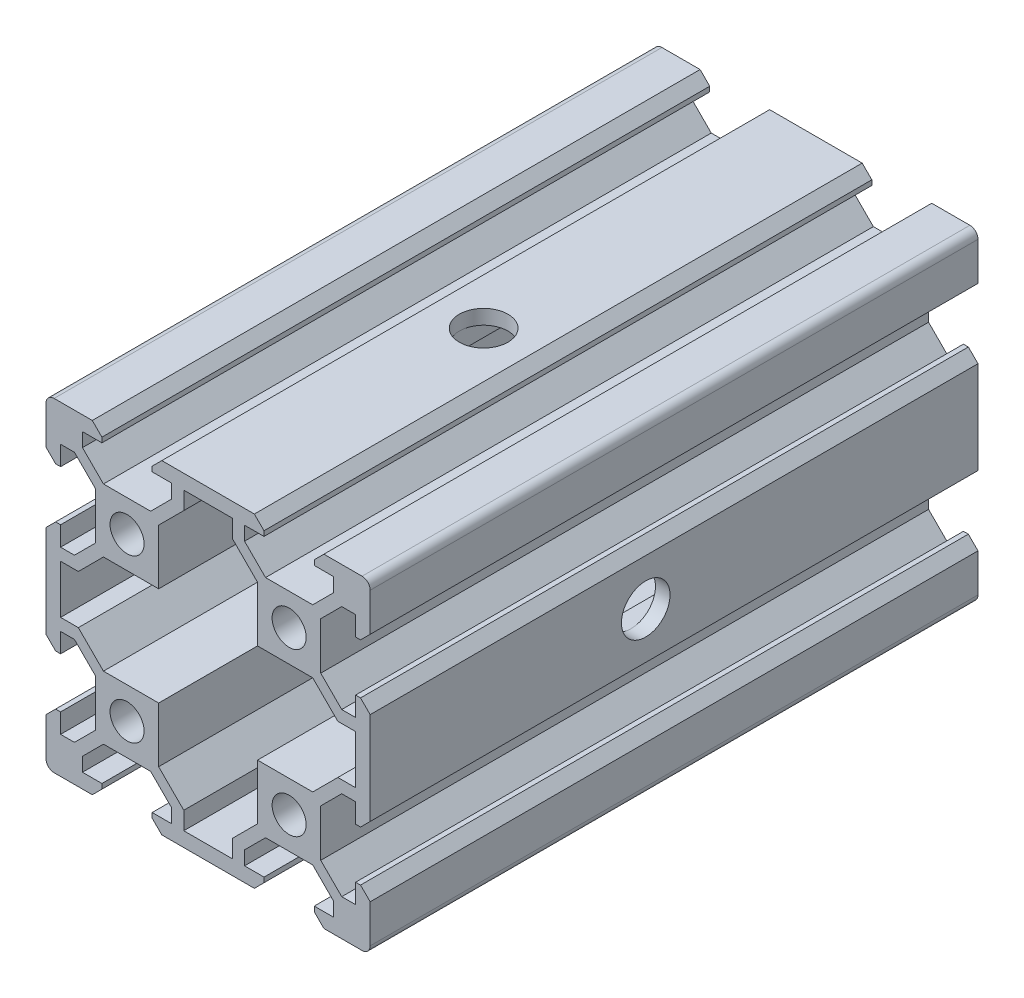
from build123d import *

# Parameters (mm, degrees)
SKETCH_1_R         = 2.1
EXTRUDE_1_DEPTH    = 75
VERRUNDUNG1_R      = 1
SKETCH1_R          = 3
CUT_EXTRUDE1_DEPTH = 88.321245983


with BuildPart() as part:
    # 草图1 → 凸台-拉伸1 (new body)
    with BuildSketch(Plane.XY):
        Polygon((5.71, 20), (-5.71, 20), (-6.9, 18.81), (-6.9, 18.2), (-4.5, 18.2), (-4.5, 16.489949494), (-7.089949494, 13.9), (-12.910050506, 13.9), (-15.5, 16.489949494), (-15.5, 18.2), (-13.1, 18.2), (-13.1, 18.81), (-14.29, 20), (-20, 20), (-20, 14.29), (-18.81, 13.1), (-18.2, 13.1), (-18.2, 15.5), (-16.489949494, 15.5), (-13.9, 12.910050506), (-13.9, 7.089949494), (-16.489949494, 4.5), (-18.2, 4.5), (-18.2, 6.9), (-18.81, 6.9), (-20, 5.71), (-20, -5.71), (-18.81, -6.9), (-18.2, -6.9), (-18.2, -4.5), (-16.489949494, -4.5), (-13.9, -7.089949494), (-13.9, -12.910050506), (-16.489949494, -15.5), (-18.2, -15.5), (-18.2, -13.1), (-18.81, -13.1), (-20, -14.29), (-20, -20), (-14.29, -20), (-13.1, -18.81), (-13.1, -18.2), (-15.5, -18.2), (-15.5, -16.489949494), (-12.910050506, -13.9), (-7.089949494, -13.9), (-4.5, -16.489949494), (-4.5, -18.2), (-6.9, -18.2), (-6.9, -18.81), (-5.71, -20), (5.71, -20), (6.9, -18.81), (6.9, -18.2), (4.5, -18.2), (4.5, -16.489949494), (7.089949494, -13.9), (12.910050506, -13.9), (15.5, -16.489949494), (15.5, -18.2), (13.1, -18.2), (13.1, -18.81), (14.29, -20), (20, -20), (20, -14.29), (18.81, -13.1), (18.2, -13.1), (18.2, -15.5), (16.489949494, -15.5), (13.9, -12.910050506), (13.9, -7.089949494), (16.489949494, -4.5), (18.2, -4.5), (18.2, -6.9), (18.81, -6.9), (20, -5.71), (20, 5.71), (18.81, 6.9), (18.2, 6.9), (18.2, 4.5), (16.489949494, 4.5), (13.9, 7.089949494), (13.9, 12.910050506), (16.489949494, 15.5), (18.2, 15.5), (18.2, 13.1), (18.81, 13.1), (20, 14.29), (20, 20), (14.29, 20), (13.1, 18.81), (13.1, 18.2), (15.5, 18.2), (15.5, 16.489949494), (12.910050506, 13.9), (7.089949494, 13.9), (4.5, 16.489949494), (4.5, 18.2), (6.9, 18.2), (6.9, 18.81), align=None)
        with Locations((-10, 10)):
            Circle(SKETCH_1_R, mode=Mode.SUBTRACT)
        with Locations((-10, -10)):
            Circle(SKETCH_1_R, mode=Mode.SUBTRACT)
        with Locations((10, -10)):
            Circle(SKETCH_1_R, mode=Mode.SUBTRACT)
        with Locations((10, 10)):
            Circle(SKETCH_1_R, mode=Mode.SUBTRACT)
        Polygon((-6.1, 6.1), (-6.1, 12.910050506), (-3, 16.010050506), (-3, 18.2), (3, 18.2), (3, 16.010050506), (6.1, 12.910050506), (6.1, 6.1), (12.910050506, 6.1), (16.010050506, 3), (18.2, 3), (18.2, -3), (16.010050506, -3), (12.910050506, -6.1), (6.1, -6.1), (6.1, -12.910050506), (3, -16.010050506), (3, -18.2), (-3, -18.2), (-3, -16.010050506), (-6.1, -12.910050506), (-6.1, -6.1), (-12.910050506, -6.1), (-16.010050506, -3), (-18.2, -3), (-18.2, 3), (-16.010050506, 3), (-12.910050506, 6.1), align=None, mode=Mode.SUBTRACT)
    extrude(amount=EXTRUDE_1_DEPTH)

    # Verrundung1
    verrundung1_edges = [part.edges().sort_by_distance(p)[0] for p in [
        (20, -20, 37.5),
        (-20, -20, 37.5),
        (-20, 20, 37.5),
        (20, 20, 37.5),
    ]]
    fillet(verrundung1_edges, radius=VERRUNDUNG1_R)

    # Sketch1 → Cut-Extrude1 (cut, through all)
    with BuildSketch(Plane.ZY.offset(20)):
        with Locations((41, 0)):
            Circle(SKETCH1_R)
    cut_extrude1 = extrude(amount=-CUT_EXTRUDE1_DEPTH, mode=Mode.SUBTRACT)

    # Mirror1: Cut-Extrude1 across plane
    add(cut_extrude1.mirror(Plane(origin=(0, 0, 0), x_dir=(0, 0, 1), z_dir=(-0.7071067811865477, -0.7071067811865475, 0))), mode=Mode.SUBTRACT)


solid = part.part
